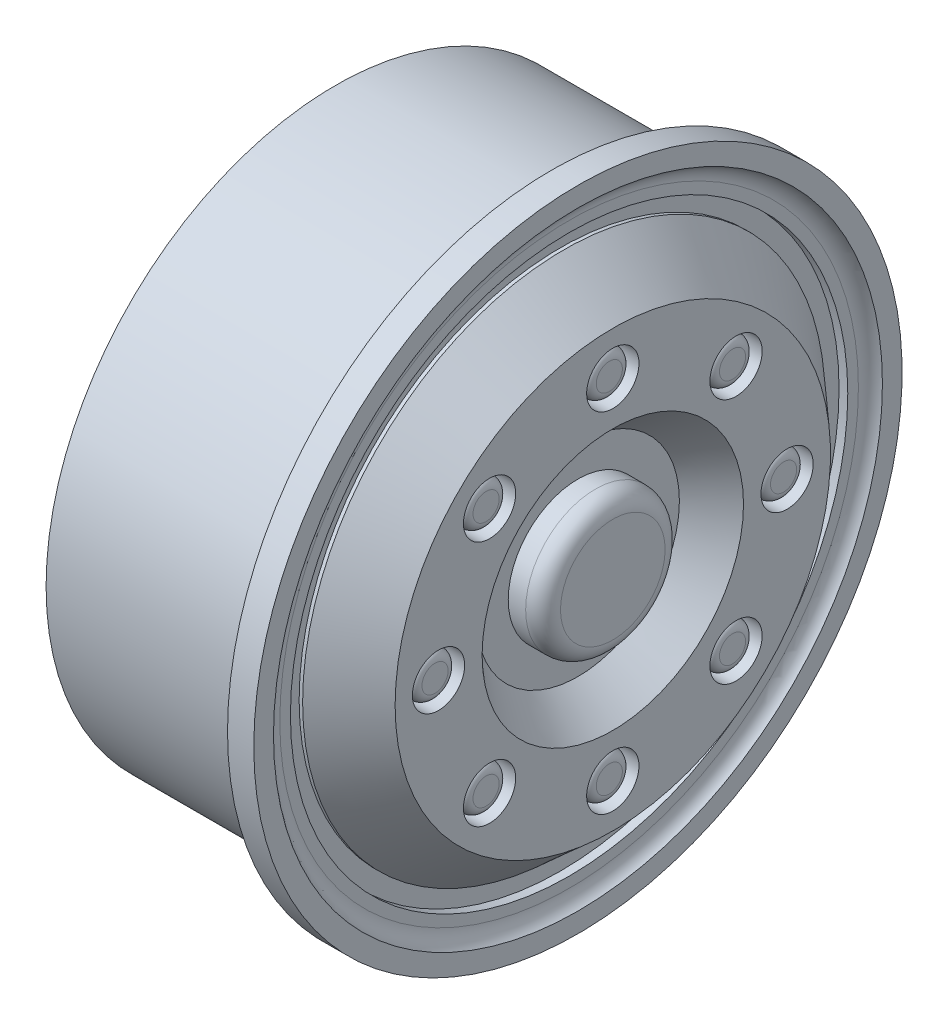
from build123d import *

# Parameters (mm, degrees)
SKETCH2_R           = 7.5
SKETCH2_R_2         = 1.4999999999999998
SKETCH2_R_3         = 1.5000000000000486
SKETCH2_R_4         = 1.5000000000000004
SKETCH2_R_5         = 1.5000000000000007
SKETCH2_R_6         = 1.4999999999999996
CUT_EXTRUDE1_DEPTH  = 2
SKETCH3_R           = 1.2499999999999998
SKETCH3_R_2         = 1.2500000000000484
SKETCH3_R_3         = 1.2500000000003157
SKETCH3_R_4         = 1.2500000000006564
SKETCH3_R_5         = 1.2500000000008784
SKETCH3_R_6         = 1.2500000000008638
SKETCH3_R_7         = 1.2500000000006306
SKETCH3_R_8         = 1.2500000000003249
BOSS_EXTRUDE1_DEPTH = 1.8
FILLET2_R           = 0.5
CHAMFER1_SIZE2      = 1.678199262
CHAMFER1_SIZE       = 2
SKETCH4_R           = 4
BOSS_EXTRUDE2_DEPTH = 2
FILLET3_R           = 1


# Some blends are built 0.0001 mm under size
with BuildPart() as part:
    # Sketch1 → Revolve1 (revolve)
    with BuildSketch(Plane.XY, mode=Mode.PRIVATE) as revolve1_sk:
        with BuildLine():
            Line((6.7179637508004015, 18.599999999999998), (5.21, 18.599999999999998))
            Line((5.21, 18.599999999999998), (5.209999999999999, 16.599999999999998))
            Line((5.209999999999999, 16.599999999999998), (-7.200000000000002, 16.6))
            Line((-7.200000000000002, 16.6), (-7.200000000000002, 13.600000000000001))
            Line((-7.200000000000002, 13.600000000000001), (2.8639359389992203, 13.600000000000001))
            Line((2.8639359389992203, 13.600000000000001), (4.994200100271213, 11.46973583872801))
            Line((4.994200100271213, 11.46973583872801), (4.9942001002712395, 0))
            Line((4.9942001002712395, 0), (8.717963750800402, 0))
            Line((8.717963750800402, 0), (8.717963750800404, 12.490754364542397))
            Line((8.717963750800404, 12.490754364542397), (5.909999999999997, 14.990754364542399))
            Line((5.909999999999997, 14.990754364542399), (5.709999999999997, 14.990754364542399))
            Line((5.709999999999997, 14.990754364542399), (5.709999999999996, 15.990754364542399))
            Line((5.709999999999996, 15.990754364542399), (6.209999999999996, 15.990754364542399))
            Line((6.209999999999996, 15.990754364542399), (6.209999999999996, 16.59999999999999))
            ThreePointArc((6.209999999999996, 16.59999999999999), (6.34627659253682, 17.103966145093295), (6.717963750800402, 17.47057471217213))
            Line((6.717963750800402, 17.47057471217213), (6.7179637508004015, 18.599999999999998))
        make_face()
    revolve(revolve1_sk.sketch.rotate(Axis((-25, 0, 0), (1, 0, 0)), 90), axis=Axis((-25, 0, 0), (1, 0, 0)))

    # Sketch2 → Cut-Extrude1 (cut)
    with BuildSketch(Plane(origin=(8.717963750800402, 0, 0), x_dir=(0, 0, -1), z_dir=(1, 0, 0))):
        Circle(SKETCH2_R)
        with Locations((0, 10)):
            Circle(SKETCH2_R_2)
        with Locations((7.071067811865598, 7.071067811865774)):
            Circle(SKETCH2_R_3)
        with Locations((10.000000000000421, 4.2247e-13)):
            Circle(SKETCH2_R_4)
        with Locations((7.071067811866196, -7.071067811865177)):
            Circle(SKETCH2_R_5)
        with Locations((8.4495e-13, -10)):
            Circle(SKETCH2_R_2)
        with Locations((-7.071067811864754, -7.071067811865775)):
            Circle(SKETCH2_R_6)
        with Locations((-9.999999999999579, -4.237e-13)):
            Circle(SKETCH2_R_4)
        with Locations((-7.071067811865353, 7.071067811865176)):
            Circle(SKETCH2_R_6)
    extrude(amount=-CUT_EXTRUDE1_DEPTH, mode=Mode.SUBTRACT)

    # Sketch3 → Boss-Extrude1 (add)
    with BuildSketch(Plane(origin=(6.717963750800403, 0, 0), x_dir=(0, 0, -1), z_dir=(1, 0, 0))):
        with Locations((0, 10)):
            Circle(SKETCH3_R)
        with Locations((7.071067811865598, 7.071067811865777)):
            Circle(SKETCH3_R_2)
        with Locations((10.000000000000423, 4.2449e-13)):
            Circle(SKETCH3_R_3)
        with Locations((7.071067811866199, -7.071067811865174)):
            Circle(SKETCH3_R_4)
        with Locations((8.4898e-13, -10)):
            Circle(SKETCH3_R_5)
        with Locations((-7.071067811864751, -7.0710678118657775)):
            Circle(SKETCH3_R_6)
        with Locations((-9.999999999999577, -4.2571e-13)):
            Circle(SKETCH3_R_7)
        with Locations((-7.071067811865353, 7.0710678118651735)):
            Circle(SKETCH3_R_8)
    extrude(amount=BOSS_EXTRUDE1_DEPTH)

    # Fillet2
    # the kernel refuses this fillet: 0.5 mm, written as the material it adds along each edge
    with BuildSketch(Plane(origin=(6.717963750800403, -7.071067811865174, -7.071067811866199), x_dir=(0, 0, -1), z_dir=(0, -1, 0))) as fillet2_piece_1:
        with BuildLine():
            CenterArc((1.7500000000006564, 0.43301270189186614), FILLET2_R, 180, 59.99999999991513)
            Line((1.2500000000006564, 0.43301270189186614), (1.2500000000006564, 0))
            Line((1.2500000000006564, 0), (1.500000000000015, 1.688e-14))
        make_face()
    revolve(axis=Axis((6.717963750800403, -7.071067811865174, -7.071067811866199), (1, 0, 0)))
    with BuildSketch(Plane(origin=(6.717963750800403, -10, -8.4898e-13), x_dir=(0, 0, -1), z_dir=(0, -1, 0))) as fillet2_piece_2:
        with BuildLine():
            CenterArc((1.7500000000008784, 0.43301270189173824), FILLET2_R, 180, 59.99999999988563)
            Line((1.2500000000008784, 0.43301270189173824), (1.2500000000008784, 0))
            Line((1.2500000000008784, 0), (1.5000000000000144, 1.776e-14))
        make_face()
    revolve(axis=Axis((6.717963750800403, -10, -8.4898e-13), (1, 0, 0)))
    # the kernel refuses this fillet: 0.5 mm, written as the material it takes off along each edge
    with BuildSketch(Plane(origin=(8.517963750800403, 10, 0), x_dir=(0, 0, -1), z_dir=(0, -1, 0))) as fillet2_2_piece_1:
        with BuildLine():
            CenterArc((1.2499999999999998 - FILLET2_R, -FILLET2_R), FILLET2_R, 0, 90)
            Line((1.2499999999999998 - FILLET2_R, 0), (1.2499999999999998, 0))
            Line((1.2499999999999998, 0), (1.2499999999999998, -FILLET2_R))
        make_face()
    revolve(axis=Axis((8.517963750800403, 10, 0), (1, 0, 0)), mode=Mode.SUBTRACT)
    with BuildSketch(Plane(origin=(8.517963750800403, 7.071067811865777, -7.071067811865598), x_dir=(0, 0, -1), z_dir=(0, -1, 0))) as fillet2_2_piece_2:
        with BuildLine():
            CenterArc((1.250000000000048 - FILLET2_R, -FILLET2_R), FILLET2_R, 0, 90)
            Line((1.250000000000048 - FILLET2_R, 0), (1.250000000000048, 0))
            Line((1.250000000000048, 0), (1.250000000000048, -FILLET2_R))
        make_face()
    revolve(axis=Axis((8.517963750800403, 7.071067811865777, -7.071067811865598), (1, 0, 0)), mode=Mode.SUBTRACT)
    with BuildSketch(Plane(origin=(8.517963750800403, 4.2449e-13, -10.000000000000423), x_dir=(0, 0, -1), z_dir=(0, -1, 0))) as fillet2_2_piece_3:
        with BuildLine():
            CenterArc((1.2500000000003162 - FILLET2_R, -FILLET2_R), FILLET2_R, 0, 90)
            Line((1.2500000000003162 - FILLET2_R, 0), (1.2500000000003162, 0))
            Line((1.2500000000003162, 0), (1.2500000000003162, -FILLET2_R))
        make_face()
    revolve(axis=Axis((8.517963750800403, 4.2449e-13, -10.000000000000423), (1, 0, 0)), mode=Mode.SUBTRACT)
    with BuildSketch(Plane(origin=(8.517963750800403, -7.071067811865174, -7.071067811866199), x_dir=(0, 0, -1), z_dir=(0, -1, 0))) as fillet2_2_piece_4:
        with BuildLine():
            CenterArc((1.2500000000006564 - FILLET2_R, -FILLET2_R), FILLET2_R, 0, 90)
            Line((1.2500000000006564 - FILLET2_R, 0), (1.2500000000006564, 0))
            Line((1.2500000000006564, 0), (1.2500000000006564, -FILLET2_R))
        make_face()
    revolve(axis=Axis((8.517963750800403, -7.071067811865174, -7.071067811866199), (1, 0, 0)), mode=Mode.SUBTRACT)
    with BuildSketch(Plane(origin=(8.517963750800403, -10, -8.4898e-13), x_dir=(0, 0, -1), z_dir=(0, -1, 0))) as fillet2_2_piece_5:
        with BuildLine():
            CenterArc((1.2500000000008784 - FILLET2_R, -FILLET2_R), FILLET2_R, 0, 90)
            Line((1.2500000000008784 - FILLET2_R, 0), (1.2500000000008784, 0))
            Line((1.2500000000008784, 0), (1.2500000000008784, -FILLET2_R))
        make_face()
    revolve(axis=Axis((8.517963750800403, -10, -8.4898e-13), (1, 0, 0)), mode=Mode.SUBTRACT)
    with BuildSketch(Plane(origin=(8.517963750800403, -7.0710678118657775, 7.071067811864751), x_dir=(0, 0, -1), z_dir=(0, -1, 0))) as fillet2_2_piece_6:
        with BuildLine():
            CenterArc((1.2500000000008633 - FILLET2_R, -FILLET2_R), FILLET2_R, 0, 90)
            Line((1.2500000000008633 - FILLET2_R, 0), (1.2500000000008633, 0))
            Line((1.2500000000008633, 0), (1.2500000000008633, -FILLET2_R))
        make_face()
    revolve(axis=Axis((8.517963750800403, -7.0710678118657775, 7.071067811864751), (1, 0, 0)), mode=Mode.SUBTRACT)
    with BuildSketch(Plane(origin=(8.517963750800403, -4.2571e-13, 9.999999999999577), x_dir=(0, 0, -1), z_dir=(0, -1, 0))) as fillet2_2_piece_7:
        with BuildLine():
            CenterArc((1.2500000000006306 - FILLET2_R, -FILLET2_R), FILLET2_R, 0, 90)
            Line((1.2500000000006306 - FILLET2_R, 0), (1.2500000000006306, 0))
            Line((1.2500000000006306, 0), (1.2500000000006306, -FILLET2_R))
        make_face()
    revolve(axis=Axis((8.517963750800403, -4.2571e-13, 9.999999999999577), (1, 0, 0)), mode=Mode.SUBTRACT)
    with BuildSketch(Plane(origin=(8.517963750800403, 7.0710678118651735, 7.071067811865353), x_dir=(0, 0, -1), z_dir=(0, -1, 0))) as fillet2_2_piece_8:
        with BuildLine():
            CenterArc((1.250000000000325 - FILLET2_R, -FILLET2_R), FILLET2_R, 0, 90)
            Line((1.250000000000325 - FILLET2_R, 0), (1.250000000000325, 0))
            Line((1.250000000000325, 0), (1.250000000000325, -FILLET2_R))
        make_face()
    revolve(axis=Axis((8.517963750800403, 7.0710678118651735, 7.071067811865353), (1, 0, 0)), mode=Mode.SUBTRACT)

    # Chamfer1
    chamfer1_edges = [part.edges().sort_by_distance(p)[0] for p in [
        (6.717963750800402, 9.2e-16, 7.5),
    ]]
    chamfer1_side = [part.faces().sort_by_distance(p)[0] for p in [
        (6.7515277360474935, 9.2e-16, 7.5),
    ]]
    chamfer(chamfer1_edges, length=CHAMFER1_SIZE - 0.0001, length2=CHAMFER1_SIZE2 - 0.0001, reference=chamfer1_side[0])  # a hair under: the kernel refuses the full size

    # Sketch4 → Boss-Extrude2 (add)
    with BuildSketch(Plane(origin=(6.717963750800403, 0, 0), x_dir=(0, 0, -1), z_dir=(1, 0, 0))):
        with Locations(Location((0, 0, 0), (0, 0, 180))):
            Circle(SKETCH4_R)
    extrude(amount=BOSS_EXTRUDE2_DEPTH)

    # Fillet3
    fillet3_edges = [part.edges().sort_by_distance(p)[0] for p in [
        (8.717963750800404, -9.8e-16, -4),
    ]]
    fillet(fillet3_edges, radius=FILLET3_R)


solid = part.part
